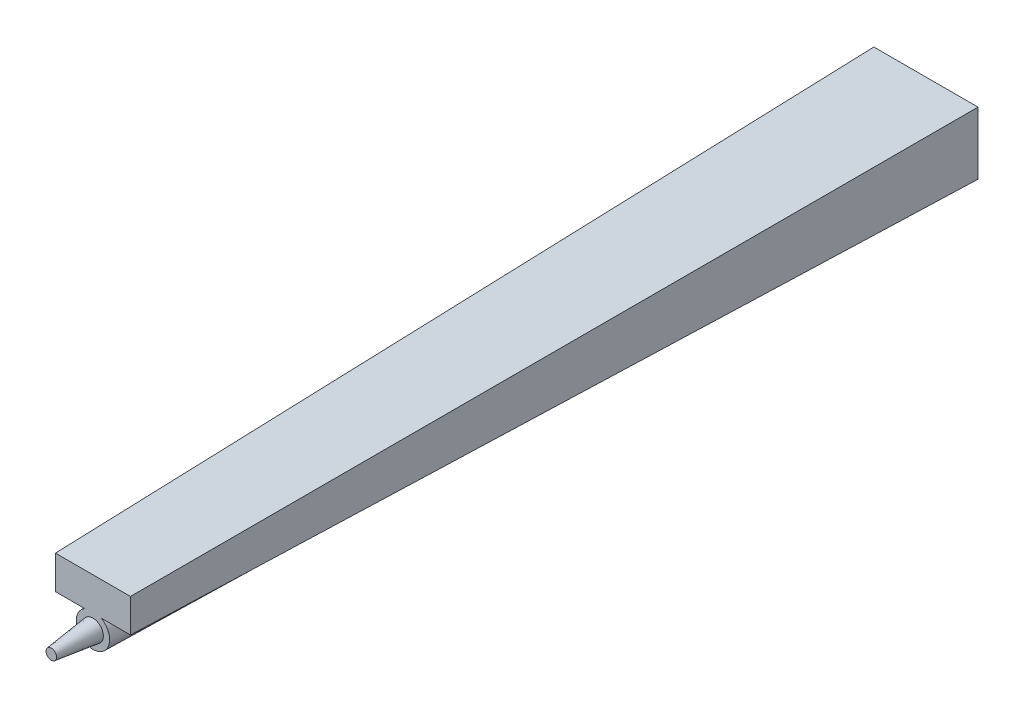
from build123d import *

# Parameters (mm, degrees)
BOSS_EXTRUDE1_DEPTH = 101.6
BOSS_EXTRUDE1_DRAFT = 1
SKETCH2_R           = 1.27
BOSS_EXTRUDE2_DEPTH = 5.08
BOSS_EXTRUDE2_TAPER = 7


with BuildPart() as part:
    # Sketch1 → Boss-Extrude1 (with draft: the straight prism first)
    with BuildSketch(Plane.XY):
        with BuildLine():
            Line((-6.35, -3.81), (-3.81, -3.81))
            ThreePointArc((-3.81, -3.81), (0, -7.62), (3.81, -3.81))
            Line((3.81, -3.81), (6.35, -3.81))
            Line((6.35, -3.81), (6.35, 3.81))
            Line((6.35, 3.81), (-6.35, 3.81))
            Line((-6.35, 3.81), (-6.35, -3.81))
        make_face()
    extrude(amount=BOSS_EXTRUDE1_DEPTH)
    # Boss-Extrude1: the draft: its side faces are tilted about the plane it starts from
    boss_extrude1_sides = [part.faces().sort_by_distance(p)[0] for p in [
        (-5.08, -3.81, 50.8),
        (0, -7.62, 50.8),
        (5.08, -3.81, 50.8),
        (6.35, 0, 50.8),
        (0, 3.81, 50.8),
        (-6.35, 0, 50.8),
    ]]
    draft(boss_extrude1_sides, Plane.XY, BOSS_EXTRUDE1_DRAFT)

    # Sketch2 → Boss-Extrude2 (add)
    with BuildSketch(Plane.XY.offset(101.6)):
        with Locations((0, -3.81)):
            Circle(SKETCH2_R)
    extrude(amount=BOSS_EXTRUDE2_DEPTH, taper=BOSS_EXTRUDE2_TAPER)


solid = part.part
